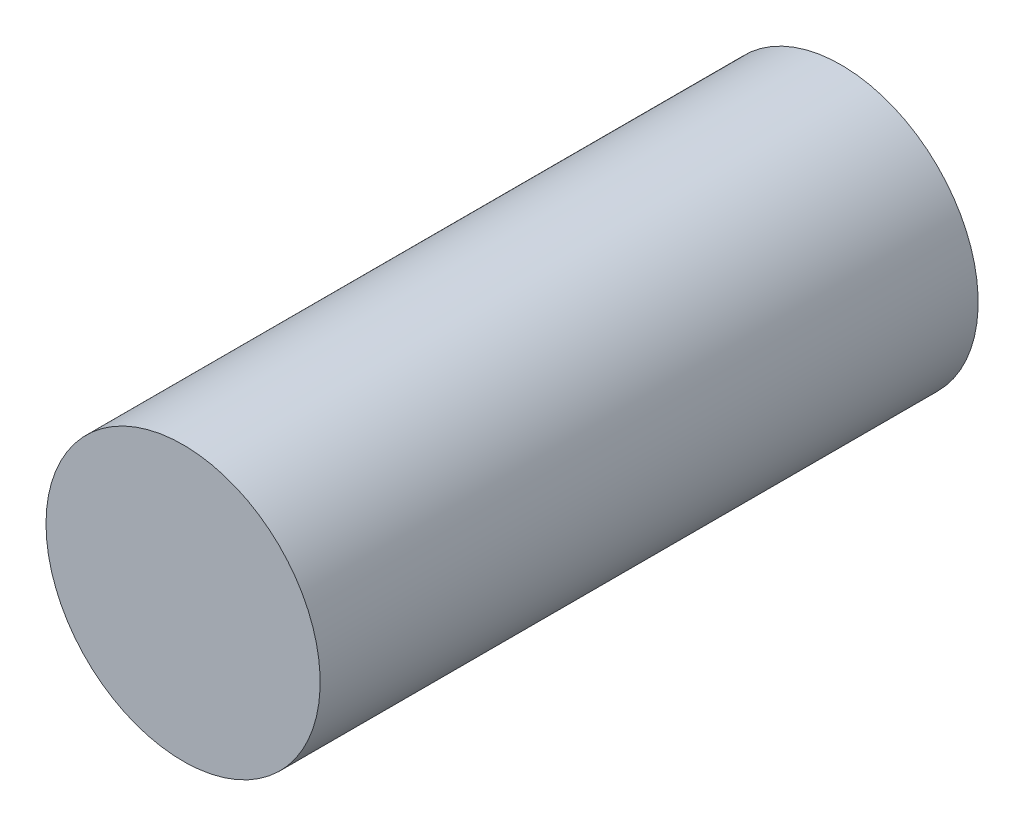
from build123d import *

# Parameters (mm, degrees)
SKETCH1_R           = 6.35
BOSS_EXTRUDE1_DEPTH = 30.48


with BuildPart() as part:
    # Sketch1 → Boss-Extrude1 (new body)
    with BuildSketch(Plane.XY):
        with Locations((-12.740923488, 14.232242724)):
            Circle(SKETCH1_R)
    extrude(amount=BOSS_EXTRUDE1_DEPTH)


solid = part.part
